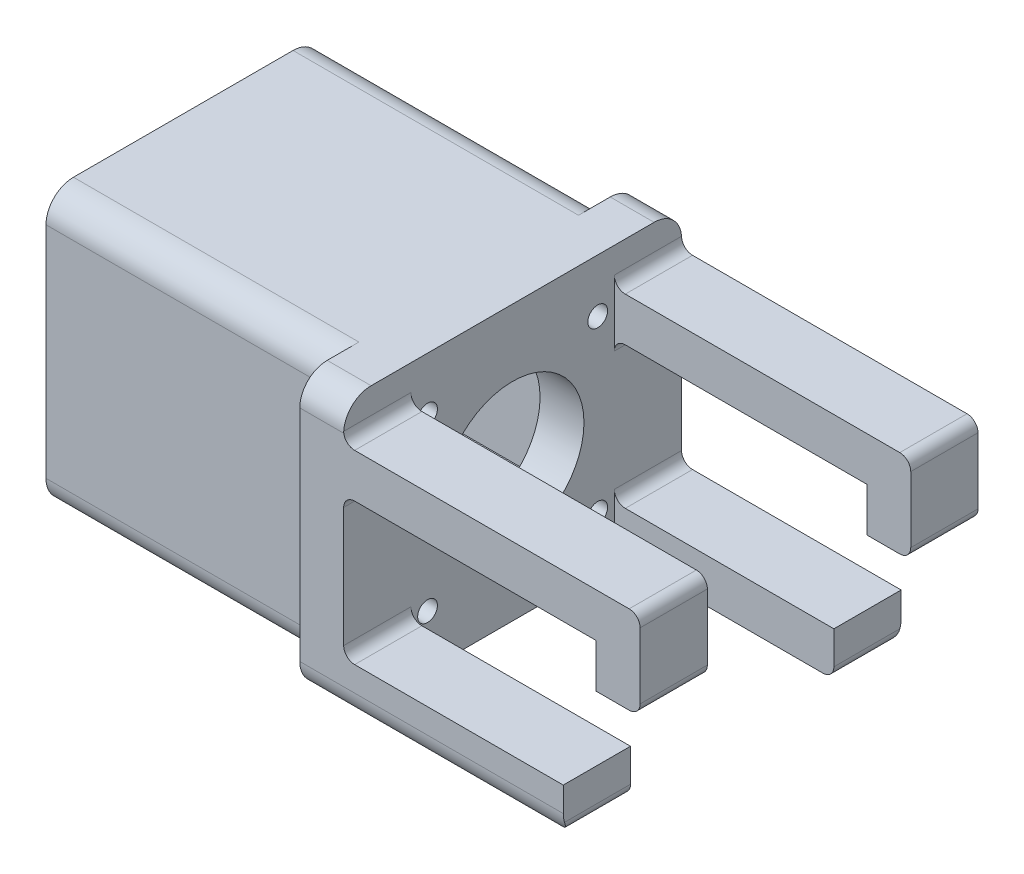
from build123d import *

# Parameters (mm, degrees)
SKETCH1_W                 = 12.25
SKETCH1_H                 = 8
BOSS_EXTRUDE1_DEPTH       = 54
BOSS_EXTRUDE1_2_DEPTH     = 54
SKETCH1_7_W               = 12.25
SKETCH1_7_H               = 8
BOSS_EXTRUDE7_DEPTH       = 40
BOSS_EXTRUDE7_2_DEPTH     = 40
BOSS_EXTRUDE2_START       = -8
BOSS_EXTRUDE2_OUTLINE_W   = 61.55
BOSS_EXTRUDE2_OUTLINE_H   = 50
BOSS_EXTRUDE2_OUTLINE_R   = 1.8
BOSS_EXTRUDE2_OUTLINE_R_2 = 13
BOSS_EXTRUDE2_DEPTH       = 8
FILLET1_R                 = 2
SKETCH2_W                 = 8
SKETCH2_H                 = 12.25
BOSS_EXTRUDE3_DEPTH       = 8
FILLET2_R                 = 5
FILLET3_R                 = 2
SKETCH3_W                 = 50
SKETCH3_H                 = 50
BOSS_EXTRUDE4_DEPTH       = 52
FILLET7_R                 = 5
SKETCH4_W                 = 20
SKETCH4_H                 = 4
CUT_EXTRUDE1_DEPTH        = 3.5
CUT_EXTRUDE1_TAPER        = -30


# Read off the part's stored shape, not the designer's step: Boss-Extrude2
with BuildPart() as part:
    # Sketch1 → Boss-Extrude1 (new body)
    with BuildSketch(Plane(origin=(0, 0, 0), x_dir=(0, 0, -1), z_dir=(1, 0, 0))):
        with Locations((6.125, 39.3)):
            Rectangle(SKETCH1_W, SKETCH1_H)
    extrude(amount=BOSS_EXTRUDE1_DEPTH)



with BuildPart() as body_2:
    # Sketch1 → Boss-Extrude1 2 (new body)
    with BuildSketch(Plane(origin=(0, 0, 0), x_dir=(0, 0, -1), z_dir=(1, 0, 0))):
        with Locations((55.425, 39.3)):
            Rectangle(SKETCH1_W, SKETCH1_H)
    extrude(amount=BOSS_EXTRUDE1_2_DEPTH)


with BuildPart() as body_3:
    # Sketch1<7> → Boss-Extrude7 (new body)
    with BuildSketch(Plane(origin=(0, 0, 0), x_dir=(0, 0, -1), z_dir=(1, 0, 0))):
        with Locations((6.125, 5.5)):
            Rectangle(SKETCH1_7_W, SKETCH1_7_H)
    extrude(amount=BOSS_EXTRUDE7_DEPTH)


with BuildPart() as body_4:
    # Sketch1<7> → Boss-Extrude7 2 (new body)
    with BuildSketch(Plane(origin=(0, 0, 0), x_dir=(0, 0, -1), z_dir=(1, 0, 0))):
        with Locations((55.425, 5.5)):
            Rectangle(SKETCH1_7_W, SKETCH1_7_H)
    extrude(amount=BOSS_EXTRUDE7_2_DEPTH)


with BuildPart() as part_1:
    add(part.part)

    add(body_2.part)  # Boss-Extrude2 merges body 2

    add(body_3.part)  # Boss-Extrude2 merges body 3

    add(body_4.part)  # Boss-Extrude2 merges body 4
    # Boss-Extrude2 outline → Boss-Extrude2 (add)
    with BuildSketch(Plane(origin=(0, 0, 0), x_dir=(0, 0, -1), z_dir=(1, 0, 0)).offset(BOSS_EXTRUDE2_START)):
        with Locations((30.775, 25)):
            Rectangle(BOSS_EXTRUDE2_OUTLINE_W, BOSS_EXTRUDE2_OUTLINE_H)
        with Locations((15.275219356, 9.300219356)):
            Circle(BOSS_EXTRUDE2_OUTLINE_R, mode=Mode.SUBTRACT)
        with Locations((46.274780644, 9.300219356)):
            Circle(BOSS_EXTRUDE2_OUTLINE_R, mode=Mode.SUBTRACT)
        with Locations((30.775, 24.8)):
            Circle(BOSS_EXTRUDE2_OUTLINE_R_2, mode=Mode.SUBTRACT)
        with Locations((15.275219356, 40.299780644)):
            Circle(BOSS_EXTRUDE2_OUTLINE_R, mode=Mode.SUBTRACT)
        with Locations((46.274780644, 40.299780644)):
            Circle(BOSS_EXTRUDE2_OUTLINE_R, mode=Mode.SUBTRACT)
    extrude(amount=BOSS_EXTRUDE2_DEPTH)

    # Fillet1
    fillet1_edges = [part_1.edges().sort_by_distance(p)[0] for p in [
        (0, 35.3, -55.425),
        (0, 43.3, -55.425),
        (0, 35.3, -6.125),
        (0, 9.5, -6.125),
        (0, 43.3, -6.125),
        (0, 9.5, -55.425),
    ]]
    fillet(fillet1_edges, radius=FILLET1_R)

    # Sketch2 → Boss-Extrude3 (add)
    with BuildSketch(Plane.XZ.offset(-35.3)):
        with Locations((50, -6.125)):
            Rectangle(SKETCH2_W, SKETCH2_H)
        with Locations((50, -55.425)):
            Rectangle(SKETCH2_W, SKETCH2_H)
    extrude(amount=BOSS_EXTRUDE3_DEPTH)

    # Fillet2
    fillet2_edges = [part_1.edges().sort_by_distance(p)[0] for p in [
        (-4, 50, -61.55),
        (-4, 0, -61.55),
        (-4, 0, 0),
        (-4, 50, 0),
    ]]
    fillet(fillet2_edges, radius=FILLET2_R)

    # Fillet3
    fillet3_edges = [part_1.edges().sort_by_distance(p)[0] for p in [
        (54, 43.3, -6.125),
        (54, 27.3, -6.125),
        (54, 27.3, -55.425),
        (40, 1.5, -54.710357107),
        (40, 1.5, -6.839642893),
        (54, 43.3, -55.425),
    ]]
    fillet(fillet3_edges, radius=FILLET3_R)

    # Sketch3 → Boss-Extrude4 (add)
    with BuildSketch(Plane.ZY.offset(8)):
        with Locations((-30.775, 25)):
            Rectangle(SKETCH3_W, SKETCH3_H)
        Polygon((-52.275, 46.5), (-9.232535772, 46.5), (-9.275, 3.5), (-52.275, 3.5), align=None, mode=Mode.SUBTRACT)
    extrude(amount=BOSS_EXTRUDE4_DEPTH)

    # Fillet7
    fillet7_edges = [part_1.edges().sort_by_distance(p)[0] for p in [
        (-34, 50, -55.775),
        (-34, 0, -55.775),
        (-34, 0, -5.775),
        (-34, 50, -5.775),
    ]]
    fillet(fillet7_edges, radius=FILLET7_R)

    # Sketch4 → Cut-Extrude1 (cut)
    with BuildSketch(Plane.XZ):
        with Locations((-50, -30.775)):
            Rectangle(SKETCH4_W, SKETCH4_H)
    extrude(amount=-CUT_EXTRUDE1_DEPTH, taper=CUT_EXTRUDE1_TAPER, mode=Mode.SUBTRACT)


solid = part_1.part
